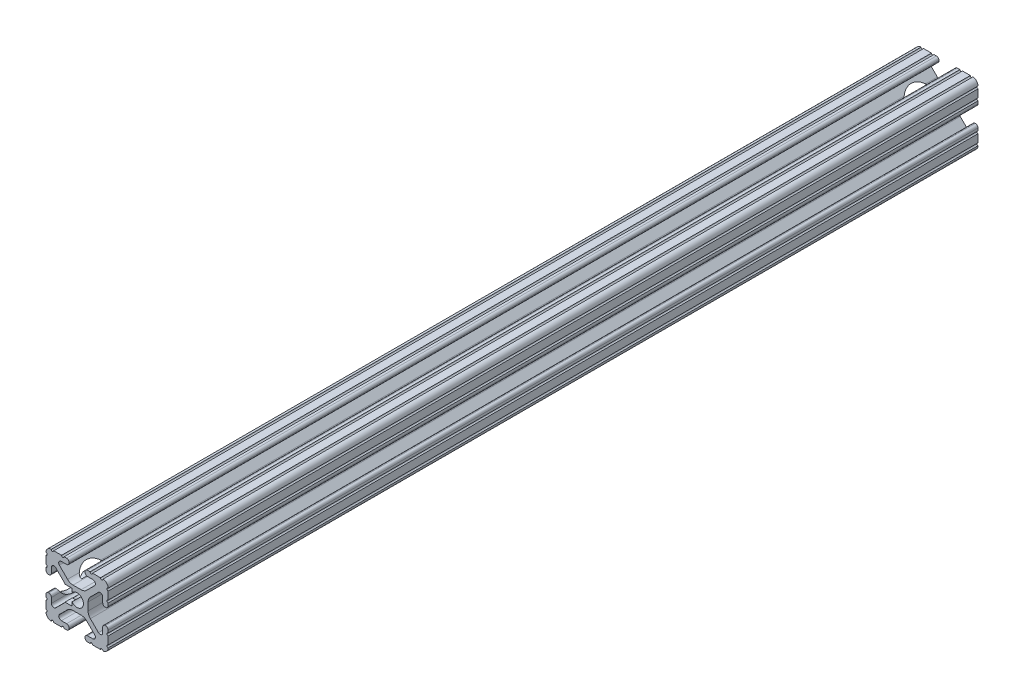
from build123d import *

# Parameters (mm, degrees)
SKETCH1_R           = 2.6035
BOSS_EXTRUDE1_DEPTH = 177.8
CUT_EXTRUDE1_DEPTH  = 10.668


with BuildPart() as part:
    # Sketch1 → Boss-Extrude1 (new, symmetric)
    with BuildSketch(Plane.XY):
        with BuildLine():
            Line((-7.179650497, -8.645192506), (-3.952270251, -5.423690499))
            ThreePointArc((-3.952270251, -5.423690499), (-2.922936451, -4.736929036), (-1.709253557, -4.4958))
            Line((-1.709253557, -4.4958), (1.709253557, -4.4958))
            ThreePointArc((1.709253557, -4.4958), (2.922936451, -4.736929036), (3.952270251, -5.423690499))
            Line((3.952270251, -5.423690499), (7.179650497, -8.645192506))
            ThreePointArc((7.179650497, -8.645192506), (7.41473083, -9.822813117), (6.416408329, -10.4902))
            Line((6.416408329, -10.4902), (4.287512407, -10.4902))
            ThreePointArc((4.287512407, -10.4902), (3.54574862, -10.79744862), (3.2385, -11.539212407))
            Line((3.2385, -11.539212407), (3.2385, -11.650987593))
            ThreePointArc((3.2385, -11.650987593), (3.54574862, -12.39275138), (4.287512407, -12.7))
            Line((4.287512407, -12.7), (5.317126718, -12.7))
            ThreePointArc((5.317126718, -12.7), (5.825126718, -12.192), (6.333126718, -12.7))
            Line((6.333126718, -12.7), (9.550443118, -12.7))
            ThreePointArc((9.550443118, -12.7), (10.058366869, -12.192000006), (10.566443095, -12.699847501))
            ThreePointArc((10.566443095, -12.699847501), (12.082537762, -12.08250727), (12.699846982, -10.566399977))
            ThreePointArc((12.699846982, -10.566399977), (12.192000006, -10.058323491), (12.7, -9.5504))
            Line((12.7, -9.5504), (12.7, -6.3330836))
            ThreePointArc((12.7, -6.3330836), (12.192, -5.8250836), (12.7, -5.3170836))
            Line((12.7, -5.3170836), (12.7, -4.287469289))
            ThreePointArc((12.7, -4.287469289), (12.39275138, -3.545705502), (11.650987593, -3.238456882))
            Line((11.650987593, -3.238456882), (11.539212407, -3.238456882))
            ThreePointArc((11.539212407, -3.238456882), (10.79744862, -3.545705502), (10.4902, -4.287469289))
            Line((10.4902, -4.287469289), (10.4902, -6.402089023))
            ThreePointArc((10.4902, -6.402089023), (9.856505071, -7.351067942), (8.737131347, -7.129408934))
            Line((8.737131347, -7.129408934), (5.441005833, -3.840816462))
            ThreePointArc((5.441005833, -3.840816462), (4.750877967, -2.809883091), (4.5085, -1.593185507))
            Line((4.5085, -1.593185507), (4.5085, 1.593185507))
            ThreePointArc((4.5085, 1.593185507), (4.750877967, 2.809883091), (5.441005833, 3.840816462))
            Line((5.441005833, 3.840816462), (8.737131347, 7.129408934))
            ThreePointArc((8.737131347, 7.129408934), (9.856505071, 7.351067942), (10.4902, 6.402089023))
            Line((10.4902, 6.402089023), (10.4902, 4.287469289))
            ThreePointArc((10.4902, 4.287469289), (10.79744862, 3.545705502), (11.539212407, 3.238456882))
            Line((11.539212407, 3.238456882), (11.650987593, 3.238456882))
            ThreePointArc((11.650987593, 3.238456882), (12.39275138, 3.545705502), (12.7, 4.287469289))
            Line((12.7, 4.287469289), (12.7, 5.3170836))
            ThreePointArc((12.7, 5.3170836), (12.192, 5.8250836), (12.7, 6.3330836))
            Line((12.7, 6.3330836), (12.7, 9.5504))
            ThreePointArc((12.7, 9.5504), (12.192000006, 10.058323491), (12.699846982, 10.566399977))
            ThreePointArc((12.699846982, 10.566399977), (12.082537762, 12.08250727), (10.566443095, 12.699847501))
            ThreePointArc((10.566443095, 12.699847501), (10.058366869, 12.192000006), (9.550443118, 12.7))
            Line((9.550443118, 12.7), (6.333126718, 12.7))
            ThreePointArc((6.333126718, 12.7), (5.825126718, 12.192), (5.317126718, 12.7))
            Line((5.317126718, 12.7), (4.287512407, 12.7))
            ThreePointArc((4.287512407, 12.7), (3.54574862, 12.39275138), (3.2385, 11.650987593))
            Line((3.2385, 11.650987593), (3.2385, 11.539212407))
            ThreePointArc((3.2385, 11.539212407), (3.54574862, 10.79744862), (4.287512407, 10.4902))
            Line((4.287512407, 10.4902), (6.476788598, 10.4902))
            ThreePointArc((6.476788598, 10.4902), (7.432222385, 9.85140422), (7.207036008, 8.724370562))
            Line((7.207036008, 8.724370562), (3.898272566, 5.423169045))
            ThreePointArc((3.898272566, 5.423169045), (2.869120213, 4.736787962), (1.655778399, 4.4958))
            Line((1.655778399, 4.4958), (-1.655778399, 4.4958))
            ThreePointArc((-1.655778399, 4.4958), (-2.869120213, 4.736787962), (-3.898272566, 5.423169045))
            Line((-3.898272566, 5.423169045), (-7.207036008, 8.724370562))
            ThreePointArc((-7.207036008, 8.724370562), (-7.432222385, 9.85140422), (-6.476788598, 10.4902))
            Line((-6.476788598, 10.4902), (-4.287512407, 10.4902))
            ThreePointArc((-4.287512407, 10.4902), (-3.54574862, 10.79744862), (-3.2385, 11.539212407))
            Line((-3.2385, 11.539212407), (-3.2385, 11.650987593))
            ThreePointArc((-3.2385, 11.650987593), (-3.54574862, 12.39275138), (-4.287512407, 12.7))
            Line((-4.287512407, 12.7), (-5.317126718, 12.7))
            ThreePointArc((-5.317126718, 12.7), (-5.825126718, 12.192), (-6.333126718, 12.7))
            Line((-6.333126718, 12.7), (-9.550443118, 12.7))
            ThreePointArc((-9.550443118, 12.7), (-10.058366869, 12.192000006), (-10.566443095, 12.699847501))
            ThreePointArc((-10.566443095, 12.699847501), (-12.082537762, 12.08250727), (-12.699846982, 10.566399977))
            ThreePointArc((-12.699846982, 10.566399977), (-12.192000006, 10.058323491), (-12.7, 9.5504))
            Line((-12.7, 9.5504), (-12.7, 6.3330836))
            ThreePointArc((-12.7, 6.3330836), (-12.192, 5.8250836), (-12.7, 5.3170836))
            Line((-12.7, 5.3170836), (-12.7, 4.287469289))
            ThreePointArc((-12.7, 4.287469289), (-12.39275138, 3.545705502), (-11.650987593, 3.238456882))
            Line((-11.650987593, 3.238456882), (-11.539212407, 3.238456882))
            ThreePointArc((-11.539212407, 3.238456882), (-10.79744862, 3.545705502), (-10.4902, 4.287469289))
            Line((-10.4902, 4.287469289), (-10.4902, 6.402089023))
            ThreePointArc((-10.4902, 6.402089023), (-9.856505071, 7.351067942), (-8.737131347, 7.129408934))
            Line((-8.737131347, 7.129408934), (-5.441005833, 3.840816462))
            ThreePointArc((-5.441005833, 3.840816462), (-4.750877967, 2.809883091), (-4.5085, 1.593185507))
            Line((-4.5085, 1.593185507), (-4.5085, -1.593185507))
            ThreePointArc((-4.5085, -1.593185507), (-4.750877967, -2.809883091), (-5.441005833, -3.840816462))
            Line((-5.441005833, -3.840816462), (-8.737131347, -7.129408934))
            ThreePointArc((-8.737131347, -7.129408934), (-9.856505071, -7.351067942), (-10.4902, -6.402089023))
            Line((-10.4902, -6.402089023), (-10.4902, -4.287469289))
            ThreePointArc((-10.4902, -4.287469289), (-10.79744862, -3.545705502), (-11.539212407, -3.238456882))
            Line((-11.539212407, -3.238456882), (-11.650987593, -3.238456882))
            ThreePointArc((-11.650987593, -3.238456882), (-12.39275138, -3.545705502), (-12.7, -4.287469289))
            Line((-12.7, -4.287469289), (-12.7, -5.3170836))
            ThreePointArc((-12.7, -5.3170836), (-12.192, -5.8250836), (-12.7, -6.3330836))
            Line((-12.7, -6.3330836), (-12.7, -9.5504))
            ThreePointArc((-12.7, -9.5504), (-12.192000006, -10.058323491), (-12.699846982, -10.566399977))
            ThreePointArc((-12.699846982, -10.566399977), (-12.082537762, -12.08250727), (-10.566443095, -12.699847501))
            ThreePointArc((-10.566443095, -12.699847501), (-10.058366869, -12.192000006), (-9.550443118, -12.7))
            Line((-9.550443118, -12.7), (-6.333126718, -12.7))
            ThreePointArc((-6.333126718, -12.7), (-5.825126718, -12.192), (-5.317126718, -12.7))
            Line((-5.317126718, -12.7), (-4.287512407, -12.7))
            ThreePointArc((-4.287512407, -12.7), (-3.54574862, -12.39275138), (-3.2385, -11.650987593))
            Line((-3.2385, -11.650987593), (-3.2385, -11.539212407))
            ThreePointArc((-3.2385, -11.539212407), (-3.54574862, -10.79744862), (-4.287512407, -10.4902))
            Line((-4.287512407, -10.4902), (-6.416408329, -10.4902))
            ThreePointArc((-6.416408329, -10.4902), (-7.41473083, -9.822813117), (-7.179650497, -8.645192506))
        make_face()
        Circle(SKETCH1_R, mode=Mode.SUBTRACT)
    extrude(amount=BOSS_EXTRUDE1_DEPTH, both=True)

    # Sketch2 → Cut-Extrude1 (cut)
    with BuildSketch(Plane.ZY.offset(12.7)):
        with BuildLine():
            Line((177.8, -3.175), (177.8, 3.175))
            Line((177.8, 3.175), (174.814203947, 3.175))
            ThreePointArc((174.814203947, 3.175), (161.6075, 0), (174.814203947, -3.175))
            Line((174.814203947, -3.175), (177.8, -3.175))
        make_face()
    cut_extrude1 = extrude(amount=-CUT_EXTRUDE1_DEPTH, mode=Mode.SUBTRACT)

    # Mirror1: Cut-Extrude1 across plane
    add(cut_extrude1.mirror(Plane.XY), mode=Mode.SUBTRACT)


solid = part.part
